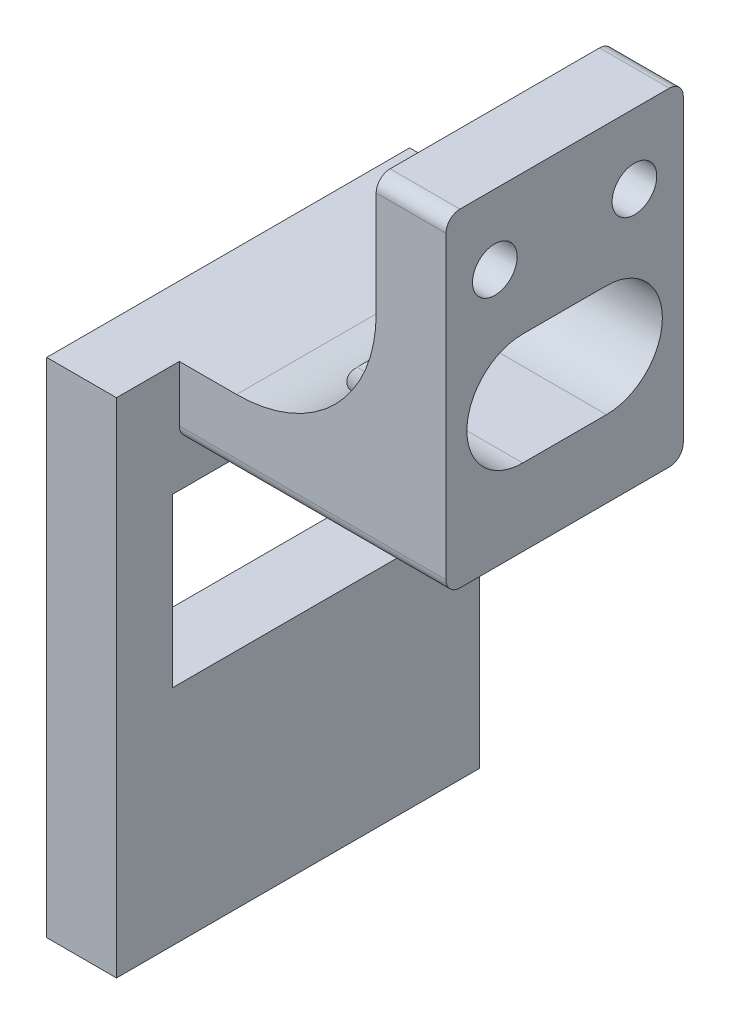
from build123d import *

# Parameters (mm, degrees)
BOSS_EXTRUDE1_START      = -8
SKETCH2_W                = 26
SKETCH2_H                = 36
SKETCH2_W_2              = 18
SKETCH2_H_2              = 12
BOSS_EXTRUDE1_DEPTH      = 5
BOSS_EXTRUDE2_START      = -3
SKETCH2_7_W              = 17
SKETCH2_7_H              = 5
BOSS_EXTRUDE2_DEPTH      = 19.1
BOSS_EXTRUDE3_START      = 11.1
SKETCH2_14_W             = 17
SKETCH2_14_H             = 18.5
BOSS_EXTRUDE3_DEPTH      = 5
M3_CLEARANCE_HOLE1_D     = 3.2
M3_CLEARANCE_HOLE1_DEPTH = 5
M3_CLEARANCE_HOLE1_TIP   = 0.96137699
FILLET1_START            = -8.5
FILLET1_DEPTH            = 17
FILLET1_2_DEPTH          = 1.500148193
FILLET1_START_2          = 6.999851807
FILLET1_3_DEPTH          = 1.500148193
FILLET1_START_3          = 5.377704746
FILLET1_4_DEPTH          = 5.722295254
FILLET1_START_4          = 5.601514307
FILLET1_5_DEPTH          = 5.498485693
FILLET1_START_5          = 4.22249738
FILLET1_6_DEPTH          = 5.871975237
FILLET1_START_6          = -6.999851807
FILLET1_7_DEPTH          = 13.999703614
FILLET3_R                = 1


with BuildPart() as part:
    # Sketch2 → Boss-Extrude1 (new body)
    with BuildSketch(Plane(origin=(0, 0, 0), x_dir=(0, 0, -1), z_dir=(1, 0, 0)).offset(BOSS_EXTRUDE1_START)):
        with Locations((0, 9.5)):
            Rectangle(SKETCH2_W, SKETCH2_H)
        with Locations((0, 13.5)):
            Rectangle(SKETCH2_W_2, SKETCH2_H_2, mode=Mode.SUBTRACT)
    extrude(amount=BOSS_EXTRUDE1_DEPTH)

    # Sketch2<7> → Boss-Extrude2 (add)
    with BuildSketch(Plane(origin=(0, 0, 0), x_dir=(0, 0, -1), z_dir=(1, 0, 0)).offset(BOSS_EXTRUDE2_START)):
        with Locations((0, 25)):
            Rectangle(SKETCH2_7_W, SKETCH2_7_H)
    extrude(amount=BOSS_EXTRUDE2_DEPTH)

    # Sketch2<14> → Boss-Extrude3 (add)
    with BuildSketch(Plane(origin=(0, 0, 0), x_dir=(0, 0, -1), z_dir=(1, 0, 0)).offset(BOSS_EXTRUDE3_START)):
        with Locations((0, 36.75)):
            Rectangle(SKETCH2_14_W, SKETCH2_14_H)
        with BuildLine():
            Line((3, 28), (-3, 28))
            ThreePointArc((-3, 28), (-7, 32), (-3, 36))
            Line((-3, 36), (3, 36))
            ThreePointArc((3, 36), (7, 32), (3, 28))
        make_face(mode=Mode.SUBTRACT)
    extrude(amount=BOSS_EXTRUDE3_DEPTH)

    # M3 Clearance Hole1
    with Locations(Plane.ZY.offset(-11.1)):
        with Locations((5, 41), (-5, 41)):
            Hole(M3_CLEARANCE_HOLE1_D / 2, depth=M3_CLEARANCE_HOLE1_DEPTH)
            with Locations((0, 0, -(M3_CLEARANCE_HOLE1_DEPTH + M3_CLEARANCE_HOLE1_TIP / 2))):  # 118° drill point
                Cone(0, M3_CLEARANCE_HOLE1_D / 2, M3_CLEARANCE_HOLE1_TIP, mode=Mode.SUBTRACT)

    # Fillet1: read off the stored shape, not the designer's step
    # Fillet1 outline → Fillet1 (add)
    with BuildSketch(Plane.XY.offset(FILLET1_START)):
        with BuildLine():
            Line((11.1, 28), (4.222498999, 28))
            ThreePointArc((4.222498999, 28), (2.68113883, 27.625791171), (1.1, 27.5))
            Line((1.1, 27.5), (11.1, 27.5))
            Line((11.1, 27.5), (11.1, 28))
        make_face()
        with BuildLine():
            ThreePointArc((11.1, 37.5), (11.071674876, 36.747869581), (10.986859967, 36))
            Line((10.986859967, 36), (11.1, 36))
            Line((11.1, 36), (11.1, 37.5))
        make_face()
    extrude(amount=FILLET1_DEPTH)

    # Fillet1 2 outline → Fillet1 2 (add)
    with BuildSketch(Plane.XY.offset(FILLET1_START)):
        with BuildLine():
            ThreePointArc((10.986859967, 36), (8.736154476, 31.04328684), (4.222498999, 28))
            Line((4.222498999, 28), (11.1, 28))
            Line((11.1, 28), (11.1, 36))
            Line((11.1, 36), (10.986859967, 36))
        make_face()
    extrude(amount=FILLET1_2_DEPTH)

    # Fillet1 3 outline → Fillet1 3 (add)
    with BuildSketch(Plane.XY.offset(FILLET1_START_2)):
        with BuildLine():
            ThreePointArc((10.986859967, 36), (8.736154476, 31.04328684), (4.222498999, 28))
            Line((4.222498999, 28), (11.1, 28))
            Line((11.1, 28), (11.1, 36))
            Line((11.1, 36), (10.986859967, 36))
        make_face()
    extrude(amount=FILLET1_3_DEPTH)

    # Fillet1 4 outline → Fillet1 4 (cut)
    with BuildSketch(Plane.YZ.offset(FILLET1_START_3)):
        with BuildLine():
            Line((31.965568589, 6.999851807), (32.034431411, 6.999851807))
            ThreePointArc((32.034431411, 6.999851807), (32, 7), (31.965568589, 6.999851807))
        make_face()
        with BuildLine():
            ThreePointArc((31.965568589, -6.999851807), (32, -7), (32.034431411, -6.999851807))
            Line((32.034431411, -6.999851807), (31.965568589, -6.999851807))
        make_face()
    extrude(amount=FILLET1_4_DEPTH, mode=Mode.SUBTRACT)

    # Fillet1 5 outline → Fillet1 5 (add)
    with BuildSketch(Plane.YZ.offset(FILLET1_START_4)):
        with BuildLine():
            ThreePointArc((32.034431411, 6.999851807), (34.840574382, 5.816227473), (36, 3))
            Line((36, 3), (36, 6.999851807))
            Line((36, 6.999851807), (32.034431411, 6.999851807))
        make_face()
        with BuildLine():
            Line((36, -6.999851807), (36, -3))
            ThreePointArc((36, -3), (34.840574382, -5.816227473), (32.034431411, -6.999851807))
            Line((32.034431411, -6.999851807), (36, -6.999851807))
        make_face()
        with BuildLine():
            ThreePointArc((28, 3), (29.159425618, 5.816227473), (31.965568589, 6.999851807))
            Line((31.965568589, 6.999851807), (28, 6.999851807))
            Line((28, 6.999851807), (28, 3))
        make_face()
        with BuildLine():
            Line((28, -6.999851807), (31.965568589, -6.999851807))
            ThreePointArc((31.965568589, -6.999851807), (29.159425618, -5.816227473), (28, -3))
            Line((28, -3), (28, -6.999851807))
        make_face()
    extrude(amount=FILLET1_5_DEPTH)

    # Fillet1 6 outline → Fillet1 6 (add)
    with BuildSketch(Plane.YZ.offset(FILLET1_START_5)):
        with BuildLine():
            ThreePointArc((28, 3), (29.159425618, 5.816227473), (31.965568589, 6.999851807))
            Line((31.965568589, 6.999851807), (28, 6.999851807))
            Line((28, 6.999851807), (28, 3))
        make_face()
        with BuildLine():
            Line((28, -6.999851807), (31.965568589, -6.999851807))
            ThreePointArc((31.965568589, -6.999851807), (29.159425618, -5.816227473), (28, -3))
            Line((28, -3), (28, -6.999851807))
        make_face()
    extrude(amount=FILLET1_6_DEPTH)

    # Fillet1 7 outline → Fillet1 7 (cut)
    with BuildSketch(Plane.XY.offset(FILLET1_START_6)):
        with BuildLine():
            ThreePointArc((4.222497538, 27.99999952), (8.736153979, 31.043286253), (10.986859967, 36))
            ThreePointArc((10.986859967, 36), (11.049747147, 36.498734945), (11.087492178, 37))
            Line((11.087492178, 37), (3, 37))
            Line((3, 37), (3, 27.682159097))
            ThreePointArc((3, 27.682159097), (3.616272245, 27.821757701), (4.222497538, 27.99999952))
        make_face()
    extrude(amount=FILLET1_7_DEPTH, mode=Mode.SUBTRACT)

    # Fillet3
    fillet3_edges = [part.edges().sort_by_distance(p)[0] for p in [
        (6.55, 22.5, -8.5),
        (6.55, 22.5, 8.5),
        (13.6, 46, -8.5),
        (13.6, 46, 8.5),
    ]]
    fillet(fillet3_edges, radius=FILLET3_R)


solid = part.part
